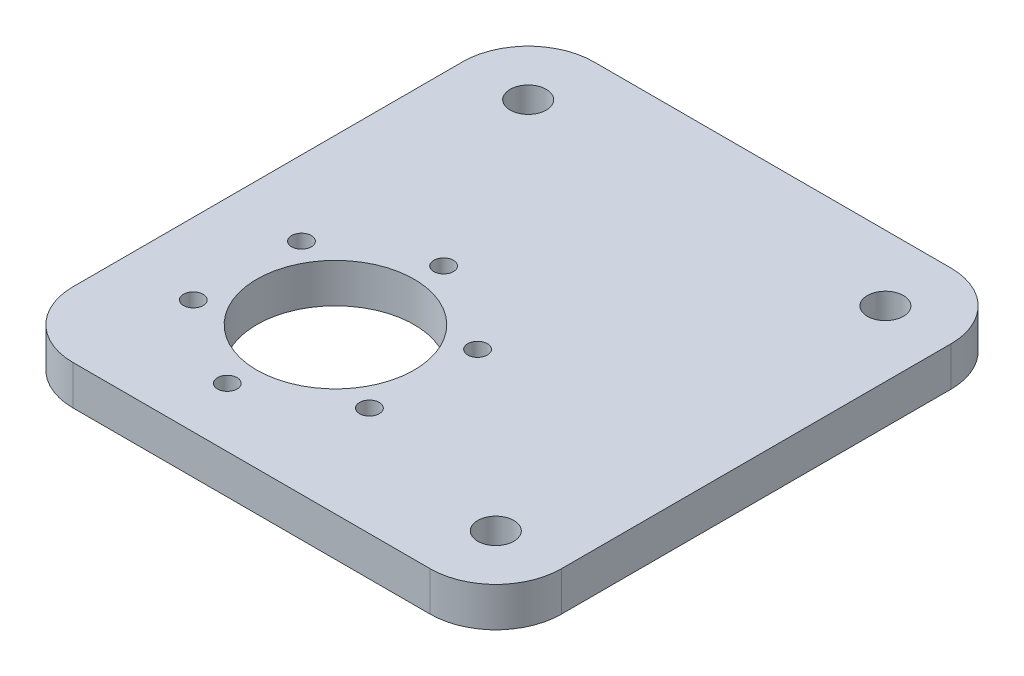
from build123d import *

# Parameters (mm, degrees)
SKETCH2_W           = 74.44
SKETCH2_H           = 79.38
SKETCH2_R           = 12
BOSS_EXTRUDE1_DEPTH = 6
SKETCH6_R           = 2.75
CUT_EXTRUDE2_DEPTH  = 10
SKETCH8_R           = 1.5
CUT_EXTRUDE4_DEPTH  = 78.515756065
FILLET1_R           = 10


with BuildPart() as part:
    # Sketch2 → Boss-Extrude1 (new body)
    with BuildSketch(Plane(origin=(0, 0, 0), x_dir=(1, 0, 0), z_dir=(0, 1, 0))):
        with Locations((18.526729133, 13.835644594)):
            Rectangle(SKETCH2_W, SKETCH2_H)
        with Locations((6.306729133, -0.854355406)):
            Circle(SKETCH2_R, mode=Mode.SUBTRACT)
    extrude(amount=BOSS_EXTRUDE1_DEPTH)

    # Sketch6 → Cut-Extrude2 (cut)
    with BuildSketch(Plane.XZ):
        with Locations((45.746729133, 15.854355406)):
            Circle(SKETCH6_R)
        with Locations((45.746729133, -43.525644594)):
            Circle(SKETCH6_R)
        with Locations((-8.693270867, -43.525644594)):
            Circle(SKETCH6_R)
    extrude(amount=-CUT_EXTRUDE2_DEPTH, mode=Mode.SUBTRACT)

    # Sketch8 → Cut-Extrude4 (cut, through all)
    with BuildSketch(Plane.XZ):
        with Locations((5.811890046, 16.846701522)):
            Circle(SKETCH8_R)
        with Locations((19.909087592, 9.279071685)):
            Circle(SKETCH8_R)
        with Locations((20.403926679, -6.713274431)):
            Circle(SKETCH8_R)
        with Locations((6.801568221, -15.137990709)):
            Circle(SKETCH8_R)
        with Locations((-7.295629325, -7.570360872)):
            Circle(SKETCH8_R)
        with Locations((-7.790468413, 8.421985243)):
            Circle(SKETCH8_R)
    extrude(amount=-CUT_EXTRUDE4_DEPTH, mode=Mode.SUBTRACT)

    # Fillet1
    fillet1_edges = [part.edges().sort_by_distance(p)[0] for p in [
        (55.746729133, 3, -53.525644594),
        (-18.693270867, 3, -53.525644594),
        (-18.693270867, 3, 25.854355406),
        (55.746729133, 3, 25.854355406),
    ]]
    fillet(fillet1_edges, radius=FILLET1_R)


solid = part.part
